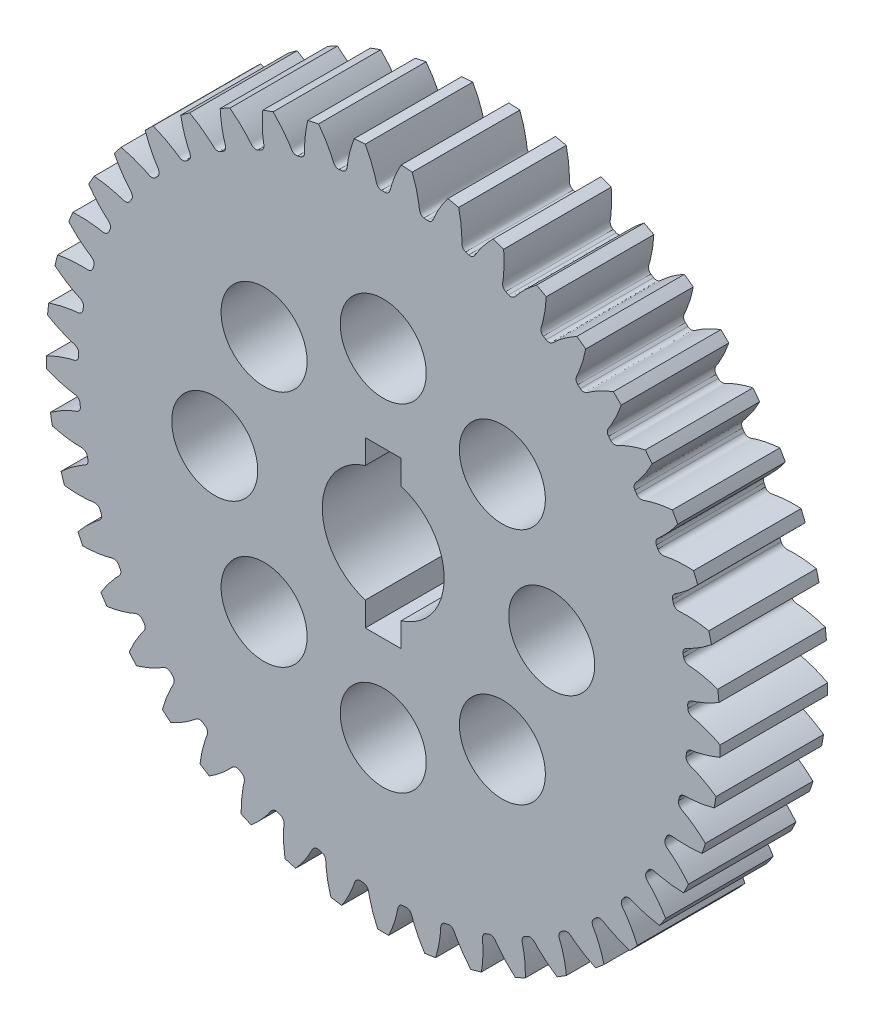
from build123d import *

# Parameters (mm, degrees)
GEAR_BASESKETCH_R                            = 47
F_2_0_90_0000MM_P_D_DEPTH                    = 7.5
TOOTH_CUT_START                              = -7.5
TOOTH_CUT_COARSE_PITCH_INVOLUTE_20_DEG_DEPTH = 15
PATTERN_CIRCULAR_1_COUNT                     = 45
SKETCH_3_R                                   = 8.5
CUT_EXTRUDE_2_DEPTH                          = 40
CUT_EXTRUDE_3_DEPTH                          = 30
SKETCH_5_R                                   = 6
CUT_EXTRUDE_4_DEPTH                          = 62.3
PATTERN_CIRCULAR_2_COUNT                     = 2


# Read off the part's stored shape, not the designer's step: Tooth-Cut, Coarse Pitch Involute 20 deg
with BuildPart() as part:
    # Gear-BaseSketch → 2.0 模数    , 90.0000mm P.D. (new, symmetric)
    with BuildSketch(Plane.XY):
        Circle(GEAR_BASESKETCH_R)
    extrude(amount=F_2_0_90_0000MM_P_D_DEPTH, both=True)

    # Tooth-Cut_ Coarse Pitch Involute 20  2 → Tooth-Cut, Coarse Pitch Involute 20 deg (cut)
    with BuildSketch(Plane.XY.offset(TOOTH_CUT_START)):
        with BuildLine():
            ThreePointArc((2.511660121, 46.93284099), (0, 47), (-2.511660121, 46.93284099))
            add(Edge.make_bspline(
                [(-2.511660121, 46.93284099), (-2.462867681, 46.844352028), (-2.350400871, 46.639113519), (-2.183958028, 46.318634428), (-2.014761898, 45.97706266), (-1.86029352, 45.648136918), (-1.719805012, 45.332391041), (-1.592726164, 45.03023334), (-1.478427707, 44.742079187), (-1.376281933, 44.468317418), (-1.285644691, 44.209319167), (-1.205873002, 43.965432433), (-1.136279348, 43.736992968), (-1.076284401, 43.524288292), (-1.034659934, 43.364979171), (-1.009051165, 43.259580758), (-0.99421846, 43.2035075), (-0.974539291, 43.137407163), (-0.946212516, 43.056029542), (-0.904200963, 42.959324637), (-0.850332939, 42.861298457), (-0.777454745, 42.759547642), (-0.67364317, 42.654408638), (-0.52425327, 42.556943054), (-0.365694602, 42.506526389), (-0.261281444, 42.501140887), (-0.227370305, 42.499391793)],
                knots=[0.021543467, 0.021543467, 0.021543467, 0.021543467, 0.079025963, 0.154677291, 0.226953984, 0.295856042, 0.361383464, 0.423536252, 0.482314405, 0.537717922, 0.589746805, 0.638401052, 0.683680665, 0.725585642, 0.764115984, 0.777340537, 0.787287501, 0.797107436, 0.816569406, 0.836266616, 0.857020698, 0.880084648, 0.907259577, 0.940589476, 0.980704744, 1, 1, 1, 1], degree=3))
            ThreePointArc((-0.227370305, 42.499391793), (0, 42.5), (0.227370305, 42.499391793))
            add(Edge.make_bspline(
                [(0.227370305, 42.499391793), (0.261281444, 42.501140887), (0.365694602, 42.506526389), (0.52425327, 42.556943054), (0.67364317, 42.654408638), (0.777454745, 42.759547642), (0.850332939, 42.861298457), (0.904200963, 42.959324637), (0.946212516, 43.056029542), (0.974539291, 43.137407163), (0.99421846, 43.2035075), (1.009051165, 43.259580758), (1.034659934, 43.364979171), (1.076284401, 43.524288292), (1.136279348, 43.736992968), (1.205873002, 43.965432433), (1.285644691, 44.209319167), (1.376281933, 44.468317418), (1.478427707, 44.742079187), (1.592726164, 45.03023334), (1.719805012, 45.332391041), (1.86029352, 45.648136918), (2.014761898, 45.97706266), (2.183958028, 46.318634428), (2.350400871, 46.639113519), (2.462867681, 46.844352028), (2.511660121, 46.93284099)],
                knots=[0, 0, 0, 0, 0.019295256, 0.059410524, 0.092740423, 0.119915352, 0.142979302, 0.163733384, 0.183430594, 0.202892564, 0.212712499, 0.222659463, 0.235884016, 0.274414358, 0.316319335, 0.361598948, 0.410253195, 0.462282078, 0.517685595, 0.576463748, 0.638616536, 0.704143958, 0.773046016, 0.845322709, 0.920974037, 0.978456533, 0.978456533, 0.978456533, 0.978456533], degree=3))
        make_face()
    tooth_cut_coarse_pitch_involute_20_deg = extrude(amount=TOOTH_CUT_COARSE_PITCH_INVOLUTE_20_DEG_DEPTH, mode=Mode.SUBTRACT)

    # 阵列(圆周)1: Tooth-Cut, Coarse Pitch Involute 20 deg ×45 about axis
    pattern_circular_1_axis = Axis((0, 0, -88.99), (0, 0, 1))
    for i in range(1, PATTERN_CIRCULAR_1_COUNT):
        add(tooth_cut_coarse_pitch_involute_20_deg.rotate(pattern_circular_1_axis, i * 360 / PATTERN_CIRCULAR_1_COUNT), mode=Mode.SUBTRACT)

    # 草图3 → 切除-拉伸2 (cut)
    with BuildSketch(Plane.XY.offset(7.5)):
        Circle(SKETCH_3_R)
    extrude(amount=-CUT_EXTRUDE_2_DEPTH, mode=Mode.SUBTRACT)

    # 草图4 → 切除-拉伸3 (cut)
    with BuildSketch(Plane.XY.offset(7.5)):
        Polygon((2.5, -5.10445022), (2.5, -8.5), (2.5, -11.5), (-2.5, -11.5), (-2.5, -8.5), (-2.5, -5.10445022), align=None)
    cut_extrude_3 = extrude(amount=-CUT_EXTRUDE_3_DEPTH, mode=Mode.SUBTRACT)

    # 草图5 → 切除-拉伸4 (cut)
    with BuildSketch(Plane.XY.offset(7.5)):
        with Locations((0, 23.5)):
            Circle(SKETCH_5_R)
        with Locations((16.617009358, 16.617009358)):
            Circle(SKETCH_5_R)
        with Locations((23.5, 0)):
            Circle(SKETCH_5_R)
        with Locations((16.617009358, -16.617009358)):
            Circle(SKETCH_5_R)
        with Locations((0, -23.5)):
            Circle(SKETCH_5_R)
        with Locations((-16.617009358, -16.617009358)):
            Circle(SKETCH_5_R)
        with Locations((-23.5, 0)):
            Circle(SKETCH_5_R)
        with Locations((-16.617009358, 16.617009358)):
            Circle(SKETCH_5_R)
    extrude(amount=-CUT_EXTRUDE_4_DEPTH, mode=Mode.SUBTRACT)

    # 阵列(圆周)2: 切除-拉伸3 ×2 about axis
    pattern_circular_2_axis = Axis((0, 0, -88.99), (0, 0, 1))
    for i in range(1, PATTERN_CIRCULAR_2_COUNT):
        add(cut_extrude_3.rotate(pattern_circular_2_axis, i * 360 / PATTERN_CIRCULAR_2_COUNT), mode=Mode.SUBTRACT)


solid = part.part
